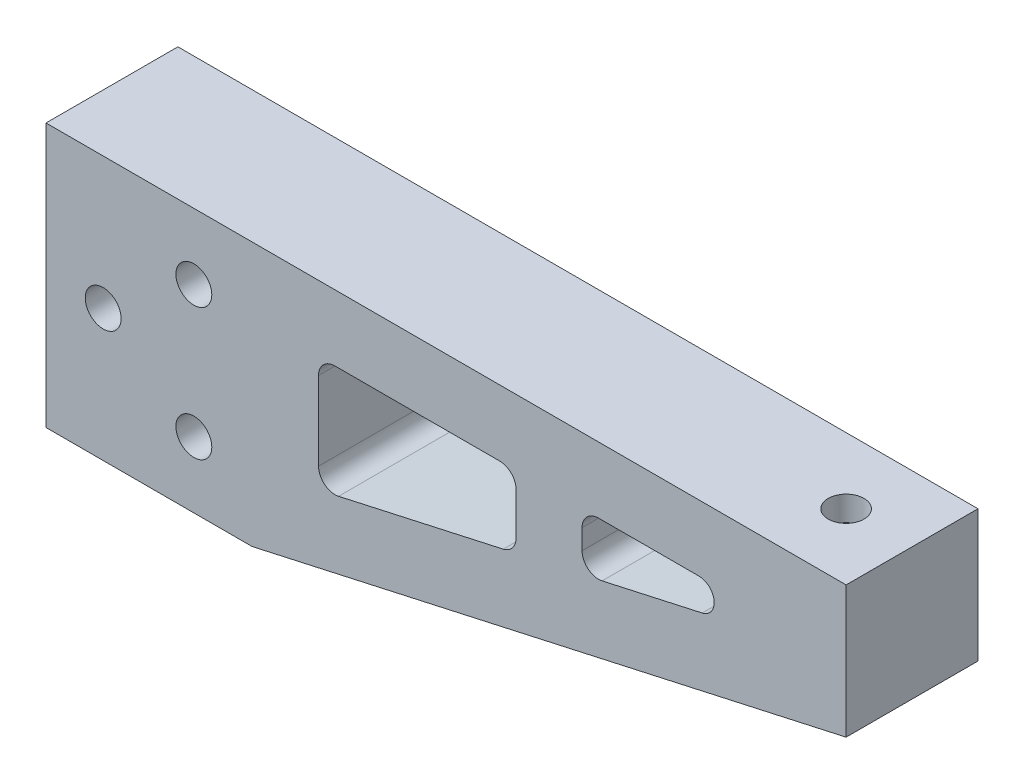
from build123d import *

# Parameters (mm, degrees)
SKETCH1_W                 = 77.04328
SKETCH1_H                 = 25.4
BOSS_EXTRUDE1_DEPTH       = 6.35
CUT_EXTRUDE1_START        = -2.38125
SKETCH2_W                 = 5.8975
SKETCH2_H                 = 5.8975
CUT_EXTRUDE1_DEPTH        = 2.1764
F_4_CLEARANCE_HOLE1_D     = 3.4544
F_4_CLEARANCE_HOLE1_DEPTH = 6.35
F_4_CLEARANCE_HOLE1_TIP   = 1.037806461
F_4_CLEARANCE_HOLE2_D     = 3.4544
CUT_EXTRUDE2_DEPTH        = 80.109082874
CUT_EXTRUDE3_DEPTH        = 80.109082874
FILLET1_R                 = 1.5875
FILLET2_R                 = 1.478727


with BuildPart() as part:
    # Sketch1 → Boss-Extrude1 (new, symmetric)
    with BuildSketch(Plane.XY):
        with Locations((-38.52164, 0)):
            Rectangle(SKETCH1_W, SKETCH1_H)
    extrude(amount=BOSS_EXTRUDE1_DEPTH, both=True)

    # Sketch2 → Cut-Extrude1 (cut)
    with BuildSketch(Plane(origin=(0, 12.7, 0), x_dir=(1, 0, 0), z_dir=(0, 1, 0)).offset(CUT_EXTRUDE1_START)):
        with Locations((-6.350000199, 1.99e-07)):
            Rectangle(SKETCH2_W, SKETCH2_H)
    extrude(amount=-CUT_EXTRUDE1_DEPTH, mode=Mode.SUBTRACT)

    # #4 Clearance Hole1
    with Locations(Plane(origin=(0, 12.7, 0), x_dir=(1, 0, 0), z_dir=(0, 1, 0))):
        with Locations((-6.350000199, 1.99e-07)):
            Hole(F_4_CLEARANCE_HOLE1_D / 2, depth=F_4_CLEARANCE_HOLE1_DEPTH)
            with Locations((0, 0, -(F_4_CLEARANCE_HOLE1_DEPTH + F_4_CLEARANCE_HOLE1_TIP / 2))):  # 118° drill point
                Cone(0, F_4_CLEARANCE_HOLE1_D / 2, F_4_CLEARANCE_HOLE1_TIP, mode=Mode.SUBTRACT)

    # #4 Clearance Hole2 (through all)
    with Locations(Plane.XY.offset(6.35)):
        with Locations((-62.80658, -6.35), (-71.53783, 0), (-62.80658, 6.35)):
            Hole(F_4_CLEARANCE_HOLE2_D / 2)

    # Sketch8 → Cut-Extrude2 (cut, through all)
    with BuildSketch(Plane(origin=(0, 0, -6.35), x_dir=(-1, 0, 0), z_dir=(0, 0, -1))):
        Polygon((0, 0), (0, -12.7), (57.19953, -12.7), align=None)
    extrude(amount=-CUT_EXTRUDE2_DEPTH, mode=Mode.SUBTRACT)

    # Sketch9 → Cut-Extrude3 (cut, through all)
    with BuildSketch(Plane.XY.offset(6.35)):
        Polygon((-12.7, 3.684857438), (-25.424765, 0.859580456), (-25.424765, 6.35), (-12.7, 6.35), align=None)
        Polygon((-31.774765, -0.550308751), (-50.801588921, -4.774830592), (-50.801588921, 6.35), (-31.774765, 6.35), align=None)
    extrude(amount=-CUT_EXTRUDE3_DEPTH, mode=Mode.SUBTRACT)

    # Fillet1
    fillet1_edges = [part.edges().sort_by_distance(p)[0] for p in [
        (-25.424765, 0.859580456, 0),
        (-25.424765, 6.35, 0),
        (-31.774765, 6.35, 0),
        (-31.774765, -0.550308751, 0),
        (-50.801588921, -4.774830592, 0),
        (-50.801588921, 6.35, 0),
    ]]
    fillet(fillet1_edges, radius=FILLET1_R)

    # Fillet2
    fillet2_edges = [part.edges().sort_by_distance(p)[0] for p in [
        (-12.7, 6.35, 0),
        (-12.7, 3.684857438, 0),
    ]]
    fillet(fillet2_edges, radius=FILLET2_R - 0.0001)  # a hair under: the kernel refuses the full size


solid = part.part
